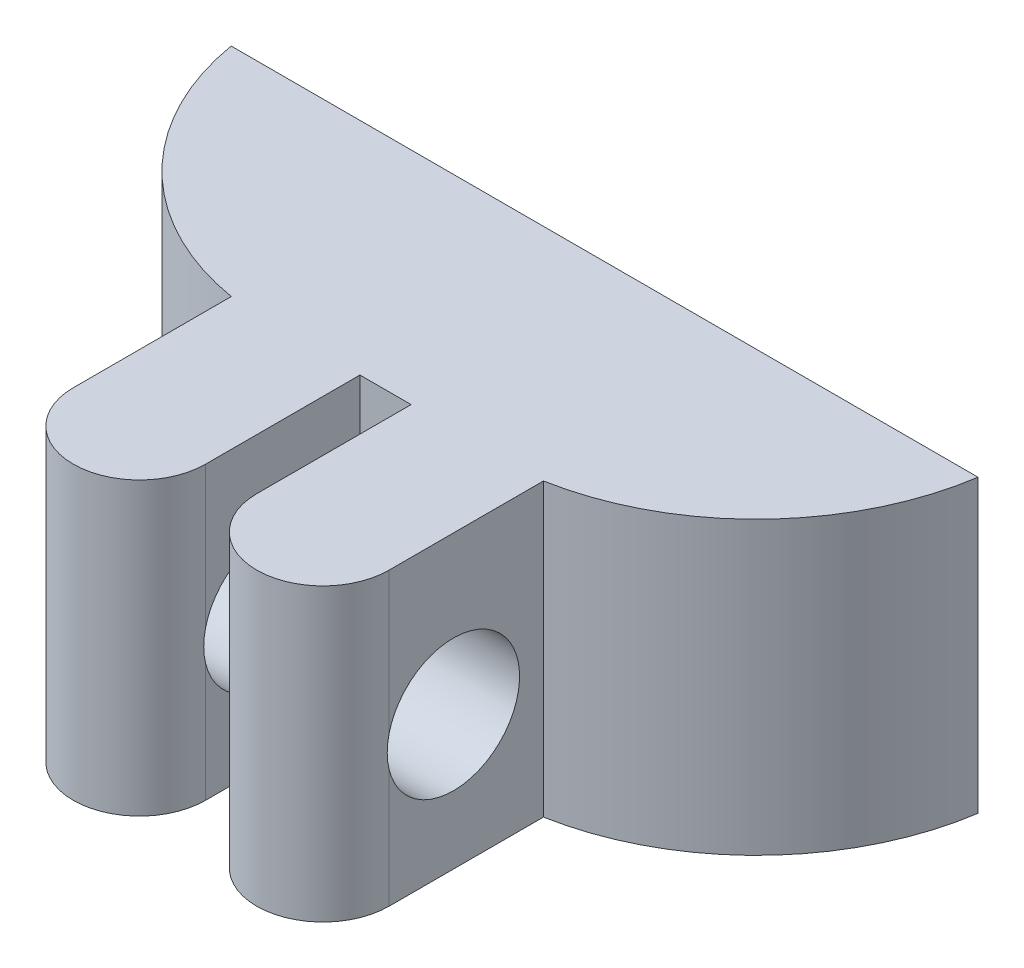
from build123d import *

# Parameters (mm, degrees)
SKETCH1_W               = 17
SKETCH1_H               = 15
BOSS_EXTRUDE1_DEPTH     = 5
SKETCH2_W               = 3
SKETCH2_H               = 15
SKETCH2_H_2             = 14.97636143
BOSS_EXTRUDE2_DEPTH     = 5
CUT_EXTRUDE2_DEPTH      = 21.185301583
CUT_EXTRUDE2_DEPTH_BACK = 21.185301583
SKETCH4_R               = 1.5
FILLET1_R               = 6
FILLET3_RADIUS          = 1.5
FILLET3_LENGTH          = 14.97636143
FILLET4_RADIUS          = 1.5
FILLET4_LENGTH          = 15
SKETCH5_W               = 17
SKETCH5_H               = 4.2
SKETCH5_W_2             = 16.931812254
CUT_EXTRUDE3_DEPTH      = 14


with BuildPart() as part:
    # Sketch1 → Boss-Extrude1 (new body)
    with BuildSketch(Plane.XY):
        with Locations((-8.5, -7.5)):
            Rectangle(SKETCH1_W, SKETCH1_H)
    extrude(amount=BOSS_EXTRUDE1_DEPTH)

    # Sketch2 → Boss-Extrude2 (add)
    with BuildSketch(Plane.XY.offset(5)):
        with Locations((-6.42, -7.5)):
            Rectangle(SKETCH2_W, SKETCH2_H)
        with Locations((-10.58, -7.511819285)):
            Rectangle(SKETCH2_W, SKETCH2_H_2)
    extrude(amount=BOSS_EXTRUDE2_DEPTH)

    # Sketch4 → Cut-Extrude2 (cut, two sides: drawn at the far end of the back side and taken through both)
    with BuildSketch(Plane(origin=(-9.08, 0, 0), x_dir=(0, 0, -1), z_dir=(1, 0, 0)).offset(-CUT_EXTRUDE2_DEPTH_BACK)):
        with Locations(Location((-7.041389116, -7.762480296, 0), (0, 0, 270))):
            Circle(SKETCH4_R)
    extrude(amount=CUT_EXTRUDE2_DEPTH + CUT_EXTRUDE2_DEPTH_BACK, mode=Mode.SUBTRACT)

    # Fillet1
    # the kernel refuses this fillet: 6 mm, written as the material it takes off along each edge
    with BuildSketch(Plane(origin=(0, -29.754999153, 5), x_dir=(0, 0, -1), z_dir=(0, 1, 0))) as fillet1_piece_1:
        with BuildLine():
            CenterArc((5.901999661, 6), FILLET1_R, 190.369759805, 79.630240195)
            Line((0, 4.92), (0, 0))
            Line((0, 0), (5.901999661, 0))
        make_face()
    extrude(amount=44.509998306, mode=Mode.SUBTRACT)
    # the kernel refuses this fillet: 6 mm, written as the material it takes off along each edge
    with BuildSketch(Plane(origin=(-17, 14.790199458, 5), x_dir=(0, 0, -1), z_dir=(0, -1, 0))) as fillet1_2_piece_1_section:
        with BuildLine():
            CenterArc((6, 5.916079783), FILLET1_R, 180, 80.405931773)
            Line((0, 5.916079783), (0, 0))
            Line((0, 0), (5, 0))
        make_face()
    fillet1_2_piece_1 = extrude(amount=44.580398916, mode=Mode.PRIVATE)
    fillet1_2_piece_1 = split(fillet1_2_piece_1, bisect_by=Plane(origin=(-17, -0.02363857, 5), z_dir=(0, 1, 0)), keep=Keep.TOP, mode=Mode.PRIVATE)
    fillet1_2_piece_1 = split(fillet1_2_piece_1, bisect_by=Plane(origin=(-12.08, 14.790199458, 5), z_dir=(-1, 0, 0)), keep=Keep.TOP, mode=Mode.PRIVATE)
    add(fillet1_2_piece_1, mode=Mode.SUBTRACT)
    with BuildSketch(Plane(origin=(-17, 14.790199458, 5), x_dir=(0, 0, -1), z_dir=(0, -1, 0))) as fillet1_2_piece_2_section:
        with BuildLine():
            CenterArc((6, 5.916079783), FILLET1_R, 180, 80.405931773)
            Line((0, 5.916079783), (0, 0))
            Line((0, 0), (5, 0))
        make_face()
    fillet1_2_piece_2 = extrude(amount=44.580398916, mode=Mode.PRIVATE)
    fillet1_2_piece_2 = split(fillet1_2_piece_2, bisect_by=Plane(origin=(-17, -0.02363857, 5), z_dir=(0, 1, 0)), keep=Keep.TOP, mode=Mode.PRIVATE)
    fillet1_2_piece_2 = split(fillet1_2_piece_2, bisect_by=Plane(origin=(-12.08, 14.790199458, 5), z_dir=(1, 0, 0)), keep=Keep.TOP, mode=Mode.PRIVATE)
    add(fillet1_2_piece_2, mode=Mode.SUBTRACT)
    with BuildSketch(Plane(origin=(-17, 14.790199458, 5), x_dir=(0, 0, -1), z_dir=(0, -1, 0))) as fillet1_2_piece_3_section:
        with BuildLine():
            CenterArc((6, 5.916079783), FILLET1_R, 180, 80.405931773)
            Line((0, 5.916079783), (0, 0))
            Line((0, 0), (5, 0))
        make_face()
    fillet1_2_piece_3 = extrude(amount=44.580398916, mode=Mode.PRIVATE)
    fillet1_2_piece_3 = split(fillet1_2_piece_3, bisect_by=Plane(origin=(-17, -0.02363857, 5), z_dir=(0, -1, 0)), keep=Keep.TOP, mode=Mode.PRIVATE)
    fillet1_2_piece_3 = split(fillet1_2_piece_3, bisect_by=Plane(origin=(-12.08, 14.790199458, 5), z_dir=(-1, 0, 0)), keep=Keep.TOP, mode=Mode.PRIVATE)
    add(fillet1_2_piece_3, mode=Mode.SUBTRACT)

    # Fillet3: full round fillet: the end face becomes a half cylinder, R = half its width
    fillet3_face = Plane((-10.58, -7.511819285, 10), x_dir=(0, -1, 0), z_dir=(0, 0, 1))  # on the end face: x along it, z out of the body
    fillet3_slab = fillet3_face.offset(-FILLET3_RADIUS / 2) * Box(FILLET3_LENGTH, 2 * FILLET3_RADIUS, FILLET3_RADIUS, mode=Mode.PRIVATE)  # the body's end, R deep
    fillet3_round = Plane((-10.58, -7.511819285, 8.5), x_dir=(0, 0, 1), z_dir=(0, -1, 0)) * Cylinder(FILLET3_RADIUS, FILLET3_LENGTH, mode=Mode.PRIVATE)  # its axis R under the face
    add(fillet3_slab - fillet3_round, mode=Mode.SUBTRACT)

    # Fillet4: full round fillet: the end face becomes a half cylinder, R = half its width
    fillet4_face = Plane((-6.42, -7.5, 10), x_dir=(0, -1, 0), z_dir=(0, 0, 1))  # on the end face: x along it, z out of the body
    fillet4_slab = fillet4_face.offset(-FILLET4_RADIUS / 2) * Box(FILLET4_LENGTH, 2 * FILLET4_RADIUS, FILLET4_RADIUS, mode=Mode.PRIVATE)  # the body's end, R deep
    fillet4_round = Plane((-6.42, -7.5, 8.5), x_dir=(0, 0, 1), z_dir=(0, -1, 0)) * Cylinder(FILLET4_RADIUS, FILLET4_LENGTH, mode=Mode.PRIVATE)  # its axis R under the face
    add(fillet4_slab - fillet4_round, mode=Mode.SUBTRACT)

    # Sketch5 → Cut-Extrude3 (cut)
    with BuildSketch(Plane.XY):
        with Locations((-8.5, -2.1)):
            Rectangle(SKETCH5_W, SKETCH5_H)
        with Locations((-8.534093873, -12.9)):
            Rectangle(SKETCH5_W_2, SKETCH5_H)
    extrude(amount=CUT_EXTRUDE3_DEPTH, mode=Mode.SUBTRACT)


solid = part.part
